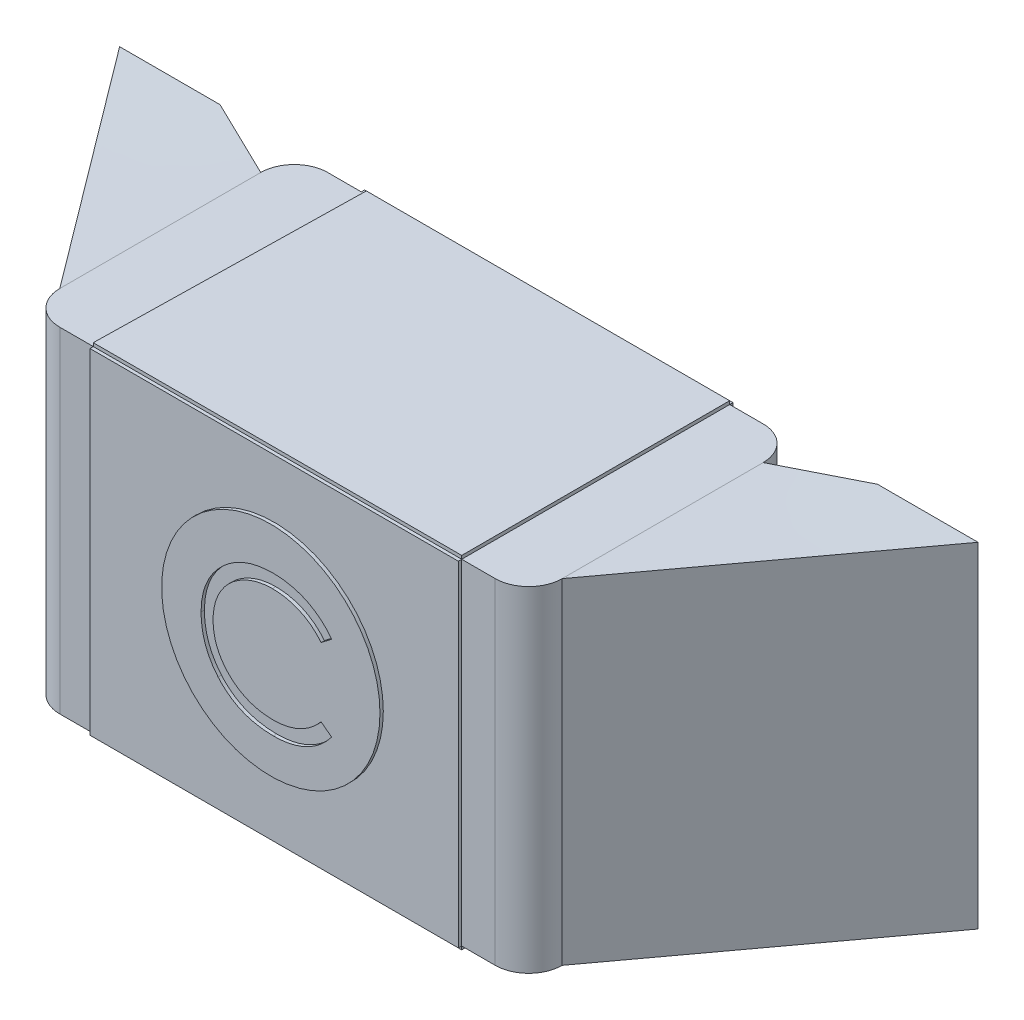
from build123d import *

# Parameters (mm, degrees)
BOSS_EXTRU_1_DEPTH      = 0.4
BOSS_EXTRU_1_DEPTH_BACK = 0.4
ESQUISSE1_W             = 1.5
ESQUISSE1_H             = 1
ESQUISSE2_W             = 1.1
ESQUISSE2_H             = 1
BOSS_EXTRU_2_DEPTH      = 0.01
BOSS_EXTRU_3_DEPTH      = 0.01
CONG_1_R                = 0.1
ESQUISSE7_R             = 0.32592
BOSS_EXTRU_4_DEPTH      = 0.01


with BuildPart() as part:
    # Esquisse1 → Boss.-Extru.1 (new, two sides: drawn at the far end of the back side and taken through both)
    with BuildSketch(Plane.XY.offset(-BOSS_EXTRU_1_DEPTH_BACK)):
        Rectangle(ESQUISSE1_W, ESQUISSE1_H)
    extrude(amount=BOSS_EXTRU_1_DEPTH + BOSS_EXTRU_1_DEPTH_BACK)

    # Esquisse2 → Boss.-Extru.2 (add)
    with BuildSketch(Plane.XY.offset(0.4)):
        Rectangle(ESQUISSE2_W, ESQUISSE2_H)
    boss_extru_2 = extrude(amount=BOSS_EXTRU_2_DEPTH)

    # Esquisse3 → Boss.-Extru.3 (add)
    with BuildSketch(Plane.XZ.offset(0.5)):
        Polygon((-0.55, 0.4), (-0.53461, -0.4), (0.55, -0.4), (0.55, 0.4), align=None)
    boss_extru_3 = extrude(amount=BOSS_EXTRU_3_DEPTH)

    # Symétrie1: Boss.-Extru.2 across plane
    add(boss_extru_2.mirror(Plane.XY))

    # Symétrie2: Boss.-Extru.3 across plane
    add(boss_extru_3.mirror(Plane.ZX))

    # Congé1
    cong_1_edges = [part.edges().sort_by_distance(p)[0] for p in [
        (-0.75, 0, 0.4),
        (-0.75, 0, -0.4),
        (0.75, 0, -0.4),
        (0.75, 0, 0.4),
    ]]
    fillet(cong_1_edges, radius=CONG_1_R)

    # Esquisse6 → section 1 of lissage3
    with BuildSketch(Plane(origin=(0, 0, -0.41), x_dir=(0, -1, 0), z_dir=(0, 0, -1)), mode=Mode.PRIVATE) as lissage3_s1:
        with BuildLine():
            Line((0.495363, 1.281354), (-0.504637, 1.281354))
            Line((-0.504637, 1.281354), (-0.504637, 0.981354))
            Line((-0.504637, 0.981354), (0.495363, 0.981354))
            Line((0.495363, 0.981354), (0.495363, 1.281354))
        make_face()
    # loft from a face of the part (lissage3)
    lissage3 = loft([part.faces().sort_by_distance((-0.75, 0, 0))[0], lissage3_s1.sketch])

    # Symétrie6: Lissage3 across plane
    add(lissage3.mirror(Plane(origin=(0, 0, 0), x_dir=(0, 0, 1), z_dir=(1, 0, 0))))

    # Esquisse7 → Boss.-Extru.4 (add)
    with BuildSketch(Plane.XY.offset(0.41)):
        Circle(ESQUISSE7_R)
        with BuildLine():
            Line((0.181557, 0.118887), (0.150146, 0.094848))
            add(Edge.make_bspline(
                [(0.150146, 0.094848), (0.147906, 0.097519), (0.143455, 0.102824), (0.136294, 0.110273), (0.128831, 0.117252), (0.121068, 0.123794), (0.112867, 0.12967), (0.104426, 0.135186), (0.095603, 0.140131), (0.083403, 0.146127), (0.067443, 0.152384), (0.047353, 0.15763), (0.02638, 0.160969), (0.012072, 0.161331), (0.004794, 0.161515)],
                knots=[0, 0, 0, 0, 0.757959, 1.505699, 2.245455, 2.979532, 3.711538, 4.438201, 5.171681, 5.909472, 7.393776, 8.890124, 10.418192, 12, 12, 12, 12], degree=3))
            add(Edge.make_bspline(
                [(0.004794, 0.161515), (0.000784, 0.161469), (-0.007197, 0.161377), (-0.019043, 0.160165), (-0.030667, 0.15846), (-0.042063, 0.155932), (-0.053215, 0.152735), (-0.064197, 0.148915), (-0.07485, 0.144189), (-0.085321, 0.138965), (-0.095352, 0.133065), (-0.104845, 0.126629), (-0.113762, 0.119729), (-0.122112, 0.112341), (-0.129903, 0.104496), (-0.137079, 0.096111), (-0.143614, 0.087214), (-0.149639, 0.077921), (-0.155035, 0.06826), (-0.159552, 0.058194), (-0.163553, 0.047896), (-0.166719, 0.03725), (-0.169224, 0.026331), (-0.170953, 0.015109), (-0.172152, 0.003608), (-0.172243, -0.004187), (-0.172289, -0.008116)],
                knots=[0, 0, 0, 0, 1.054918, 2.100045, 3.131103, 4.146048, 5.169674, 6.183596, 7.203666, 8.234916, 9.262204, 10.264457, 11.251631, 12.227803, 13.197193, 14.159521, 15.129726, 16.100847, 17.073215, 18.039054, 19.002614, 19.979014, 20.959657, 21.949031, 22.966165, 24, 24, 24, 24], degree=3))
            add(Edge.make_bspline(
                [(-0.172289, -0.008116), (-0.172145, -0.014028), (-0.171862, -0.025636), (-0.169342, -0.042639), (-0.165513, -0.058927), (-0.159774, -0.074399), (-0.152698, -0.089245), (-0.143756, -0.103215), (-0.1334, -0.11652), (-0.121483, -0.128845), (-0.108408, -0.140104), (-0.094379, -0.150018), (-0.079433, -0.158283), (-0.063732, -0.16516), (-0.047158, -0.170446), (-0.029739, -0.174168), (-0.011514, -0.176596), (0.00094, -0.176828), (0.007278, -0.176946)],
                knots=[0, 0, 0, 0, 1.029171, 2.020642, 2.987624, 3.938343, 4.88921, 5.84687, 6.821221, 7.821439, 8.8276, 9.822698, 10.80774, 11.797342, 12.803665, 13.832037, 14.896652, 16, 16, 16, 16], degree=3))
            add(Edge.make_bspline(
                [(0.007278, -0.176946), (0.014261, -0.176753), (0.028006, -0.176374), (0.048162, -0.173155), (0.067457, -0.167937), (0.085893, -0.160635), (0.103417, -0.151141), (0.120057, -0.139633), (0.135826, -0.126), (0.145308, -0.115591), (0.150146, -0.11028)],
                knots=[0, 0, 0, 0, 1.028122, 2.023589, 2.998038, 3.967518, 4.937445, 5.927276, 6.942489, 8, 8, 8, 8], degree=3))
            Line((0.150146, -0.11028), (0.181557, -0.134078))
            add(Edge.make_bspline(
                [(0.181557, -0.134078), (0.179029, -0.137339), (0.173985, -0.143847), (0.165819, -0.153021), (0.157216, -0.16165), (0.148112, -0.169664), (0.138613, -0.177225), (0.128548, -0.184116), (0.118048, -0.190435), (0.107151, -0.196221), (0.095866, -0.201355), (0.084209, -0.205749), (0.072228, -0.209535), (0.059924, -0.21265), (0.047271, -0.215081), (0.034314, -0.216706), (0.021026, -0.217819), (0.012061, -0.217921), (0.007518, -0.217972)],
                knots=[0, 0, 0, 0, 0.986788, 1.968849, 2.9356, 3.899624, 4.868463, 5.837807, 6.815139, 7.79826, 8.787526, 9.778297, 10.776456, 11.791383, 12.812565, 13.856202, 14.913612, 16, 16, 16, 16], degree=3))
            add(Edge.make_bspline(
                [(0.007518, -0.217972), (0.003216, -0.217942), (-0.005291, -0.217883), (-0.017851, -0.216924), (-0.030078, -0.215615), (-0.041938, -0.213645), (-0.053495, -0.21132), (-0.064645, -0.208203), (-0.075497, -0.204712), (-0.086008, -0.200608), (-0.096186, -0.195978), (-0.105999, -0.190745), (-0.115442, -0.184952), (-0.124609, -0.178729), (-0.133363, -0.171874), (-0.14178, -0.164484), (-0.149908, -0.156583), (-0.154937, -0.150885), (-0.157466, -0.14802)],
                knots=[0, 0, 0, 0, 1.114605, 2.203993, 3.262668, 4.300478, 5.318619, 6.316057, 7.298881, 8.27193, 9.238335, 10.195173, 11.151987, 12.108099, 13.064862, 14.031168, 15.010109, 16, 16, 16, 16], degree=3))
            add(Edge.make_bspline(
                [(-0.157466, -0.14802), (-0.161516, -0.143044), (-0.169566, -0.133152), (-0.179866, -0.117119), (-0.188683, -0.10038), (-0.195812, -0.082846), (-0.201385, -0.064557), (-0.205245, -0.045504), (-0.207754, -0.025704), (-0.208041, -0.012237), (-0.208187, -0.005392)],
                knots=[0, 0, 0, 0, 0.994628, 1.977248, 2.950238, 3.925871, 4.90891, 5.911661, 6.938485, 8, 8, 8, 8], degree=3))
            add(Edge.make_bspline(
                [(-0.208187, -0.005392), (-0.208009, 0.001803), (-0.207659, 0.015959), (-0.204689, 0.036733), (-0.199909, 0.056636), (-0.193121, 0.07563), (-0.184515, 0.093817), (-0.173883, 0.111056), (-0.16135, 0.127458), (-0.147013, 0.142774), (-0.131291, 0.156778), (-0.114454, 0.169099), (-0.096536, 0.179352), (-0.077734, 0.187923), (-0.057908, 0.194511), (-0.037098, 0.199123), (-0.015345, 0.201994), (-0.000504, 0.202356), (0.007037, 0.202541)],
                knots=[0, 0, 0, 0, 1.032926, 2.032217, 3.007277, 3.968223, 4.923963, 5.891752, 6.871518, 7.883895, 8.900124, 9.891469, 10.874488, 11.859929, 12.854644, 13.869047, 14.917253, 16, 16, 16, 16], degree=3))
            add(Edge.make_bspline(
                [(0.007037, 0.202541), (0.011633, 0.202486), (0.020731, 0.202377), (0.034188, 0.201313), (0.04729, 0.19954), (0.060046, 0.197127), (0.072517, 0.194132), (0.084608, 0.19023), (0.096391, 0.185769), (0.107791, 0.180631), (0.118752, 0.174863), (0.129273, 0.16853), (0.139269, 0.161639), (0.148811, 0.154249), (0.157738, 0.146203), (0.166305, 0.137723), (0.174221, 0.128565), (0.179107, 0.122119), (0.181557, 0.118887)],
                knots=[0, 0, 0, 0, 1.096761, 2.170927, 3.21944, 4.250916, 5.268269, 6.278327, 7.281116, 8.27403, 9.260641, 10.235838, 11.203064, 12.1569, 13.114053, 14.069677, 15.032186, 16, 16, 16, 16], degree=3))
        make_face(mode=Mode.SUBTRACT)
    extrude(amount=BOSS_EXTRU_4_DEPTH)


solid = part.part
